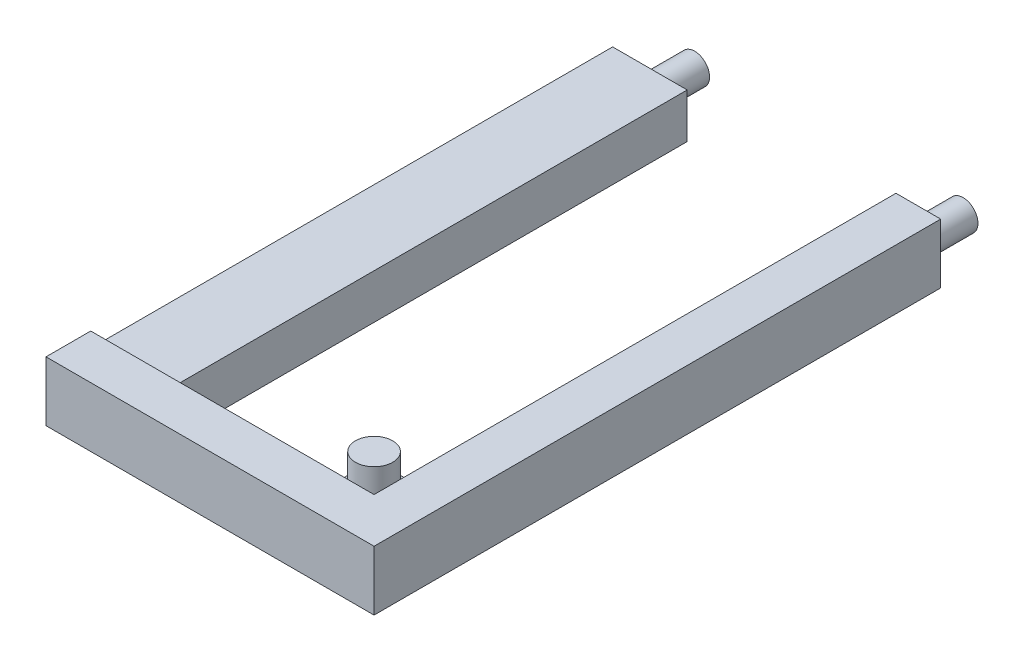
from build123d import *

# Parameters (mm, degrees)
CROQUIS1_W              = 5
CROQUIS1_H              = 35
SALIENTE_EXTRUIR1_DEPTH = 3
CROQUIS3_W              = 19
CROQUIS3_H              = 4
SALIENTE_EXTRUIR2_DEPTH = 3
CROQUIS4_W              = 5
CROQUIS4_H              = 5
SALIENTE_EXTRUIR5_DEPTH = 4
CROQUIS6_W              = 5
CROQUIS6_H              = 5
CROQUIS6_R              = 1.25
CORTAR_EXTRUIR1_DEPTH   = 3
CROQUIS11_W             = 38
CROQUIS11_H             = 4
SALIENTE_EXTRUIR8_DEPTH = 3
CROQUIS12_R             = 1
SALIENTE_EXTRUIR9_DEPTH = 3


with BuildPart() as part:
    # Croquis1 → Saliente-Extruir1 (new body)
    with BuildSketch(Plane(origin=(0, 0, 0), x_dir=(1, 0, 0), z_dir=(0, 1, 0))):
        Rectangle(CROQUIS1_W, CROQUIS1_H)
    extrude(amount=SALIENTE_EXTRUIR1_DEPTH)

    # Croquis3 → Saliente-Extruir2 (add)
    with BuildSketch(Plane.XY.offset(17.5)):
        with Locations((7, 2)):
            Rectangle(CROQUIS3_W, CROQUIS3_H)
    extrude(amount=SALIENTE_EXTRUIR2_DEPTH)

    # Croquis4 → Saliente-Extruir5 (add)
    with BuildSketch(Plane(origin=(0, 4, 0), x_dir=(1, 0, 0), z_dir=(0, 1, 0))):
        with Locations((14, -15)):
            Rectangle(CROQUIS4_W, CROQUIS4_H)
    extrude(amount=-SALIENTE_EXTRUIR5_DEPTH)

    # Croquis6 → Cortar-Extruir1 (cut)
    with BuildSketch(Plane(origin=(0, 4, 0), x_dir=(1, 0, 0), z_dir=(0, 1, 0))):
        with Locations((14, -15)):
            Rectangle(CROQUIS6_W, CROQUIS6_H)
        with Locations((14, -15)):
            Circle(CROQUIS6_R, mode=Mode.SUBTRACT)
    extrude(amount=-CORTAR_EXTRUIR1_DEPTH, mode=Mode.SUBTRACT)

    # Croquis11 → Saliente-Extruir8 (add)
    with BuildSketch(Plane(origin=(16.5, 0, 0), x_dir=(0, 0, -1), z_dir=(1, 0, 0))):
        with Locations((-1.5, 2)):
            Rectangle(CROQUIS11_W, CROQUIS11_H)
    extrude(amount=SALIENTE_EXTRUIR8_DEPTH)

    # Croquis12 → Saliente-Extruir9 (add)
    with BuildSketch(Plane(origin=(0, 0, -17.5), x_dir=(-1, 0, 0), z_dir=(0, 0, -1))):
        with Locations((-18, 2)):
            Circle(CROQUIS12_R)
        with Locations((0, 1.5)):
            Circle(CROQUIS12_R)
    extrude(amount=SALIENTE_EXTRUIR9_DEPTH)


solid = part.part
